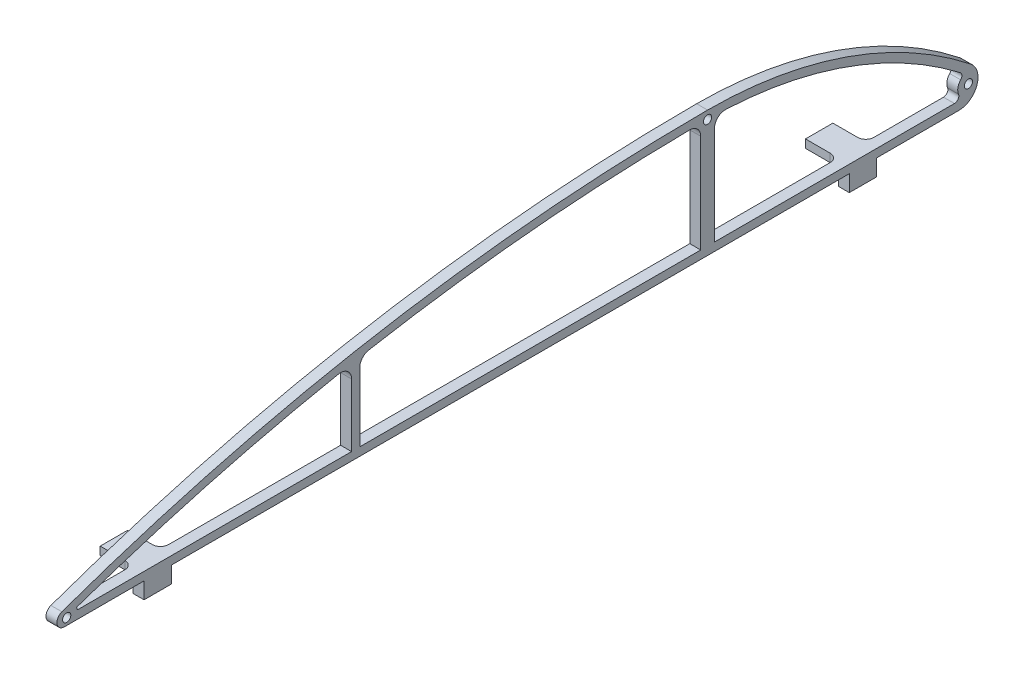
from build123d import *

# Parameters (mm, degrees)
BOSS_EXTRU_1_DEPTH      = 2
ESQUISSE4_R             = 0.75
ENL_V_MAT_EXTRU_2_DEPTH = 176.894862906
ENL_V_MAT_EXTRU_3_DEPTH = 4
CONG_2_R                = 1.35
ESQUISSE12_W            = 2
ESQUISSE12_H            = 5
BOSS_EXTRU_2_DEPTH      = 3
CONG_3_R                = 2
CONG_4_R                = 0.8
ESQUISSE13_W            = 5
ESQUISSE13_H            = 1.5
BOSS_EXTRU_3_DEPTH      = 6
CONG_5_R                = 1.5


with BuildPart() as part:
    # Esquisse2 → Boss.-Extru.1 (new body)
    with BuildSketch(Plane(origin=(0, 0, 0), x_dir=(0, 0, -1), z_dir=(1, 0, 0))):
        with BuildLine():
            Line((0, 0), (170.873171093, 0))
            ThreePointArc((170.873171093, 0), (174.177922559, 2.347343181), (173.049882129, 6.240789861))
            ThreePointArc((173.049882129, 6.240789861), (150.444362328, 18.689979585), (125, 23))
            ThreePointArc((125, 23), (61.450806457, 17.202138822), (0, 0))
        make_face()
    extrude(amount=BOSS_EXTRU_1_DEPTH)

    # Esquisse4 → Enlèv. mat.-Extru.2 (cut, through all)
    with BuildSketch(Plane(origin=(2, 0, 0), x_dir=(0, 0, -1), z_dir=(1, 0, 0))):
        with Locations((125, 21.5)):
            Circle(ESQUISSE4_R)
        with Locations((172.618958832, 3.328337296)):
            Circle(ESQUISSE4_R)
        with Locations((8, 1.25)):
            Circle(ESQUISSE4_R)
    extrude(amount=-ENL_V_MAT_EXTRU_2_DEPTH, mode=Mode.SUBTRACT)

    # Esquisse9 → Enlèv. mat.-Extru.3 (cut)
    with BuildSketch(Plane(origin=(0, 0, 0), x_dir=(0, 0, -1), z_dir=(1, 0, 0))):
        with BuildLine():
            Line((126.249998003, 1.5), (171.940959768, 1.5))
            ThreePointArc((171.940959768, 1.5), (170.669151645, 3.355758734), (171.992643995, 5.175018028))
            ThreePointArc((171.992643995, 5.175018028), (150.464605834, 17.100795028), (126.249998003, 21.497765776))
            Line((126.249998003, 21.497765776), (126.249998003, 1.5))
        make_face()
        with BuildLine():
            Line((9.933907961, 1.5), (60, 1.5))
            Line((60, 1.5), (60, 15.405547145))
            ThreePointArc((60, 15.405547145), (34.654135968, 9.627019927), (9.807619224, 1.981445651))
            ThreePointArc((9.807619224, 1.981445651), (9.886187662, 1.744768736), (9.933907961, 1.5))
        make_face()
        with BuildLine():
            Line((61.5, 1.5), (123.750001997, 1.5))
            Line((123.750001997, 1.5), (123.750001997, 21.497765776))
            ThreePointArc((123.750001997, 21.497765776), (92.494848054, 19.985907384), (61.5, 15.685935533))
            Line((61.5, 15.685935533), (61.5, 1.5))
        make_face()
    extrude(amount=ENL_V_MAT_EXTRU_3_DEPTH, mode=Mode.SUBTRACT)

    # Congé2
    cong_2_edges = [part.edges().sort_by_distance(p)[0] for p in [
        (1, 0, 0),
    ]]
    fillet(cong_2_edges, radius=CONG_2_R)

    # Esquisse12 → Boss.-Extru.2 (add)
    with BuildSketch(Plane.XZ):
        with Locations((1, -153.373171093)):
            Rectangle(ESQUISSE12_W, ESQUISSE12_H)
        with Locations((1, -24.612741703)):
            Rectangle(ESQUISSE12_W, ESQUISSE12_H)
    extrude(amount=BOSS_EXTRU_2_DEPTH)

    # Congé3
    cong_3_edges = [part.edges().sort_by_distance(p)[0] for p in [
        (1, 15.405547145, -60),
        (1, 21.497765776, -126.249998003),
        (1, 21.497765776, -123.750001997),
        (1, 15.685935533, -61.5),
    ]]
    fillet(cong_3_edges, radius=CONG_3_R)

    # Congé4
    cong_4_edges = [part.edges().sort_by_distance(p)[0] for p in [
        (1, 5.175018028, -171.992643995),
        (1, 1.5, -171.940959768),
    ]]
    fillet(cong_4_edges, radius=CONG_4_R)

    # Esquisse13 → Boss.-Extru.3 (add)
    with BuildSketch(Plane.ZY):
        with Locations((-153.373171093, 0.75)):
            Rectangle(ESQUISSE13_W, ESQUISSE13_H)
        with Locations((-24.612741703, 0.75)):
            Rectangle(ESQUISSE13_W, ESQUISSE13_H)
    extrude(amount=BOSS_EXTRU_3_DEPTH)

    # Congé5
    # the kernel refuses this fillet: 1.5 mm, written as the material it adds along each edge
    with BuildSketch(Plane(origin=(0, 1.5, -155.873171093), x_dir=(0, 0, -1), z_dir=(0, -1, 0)), Plane(origin=(0, 0, -150.873171093), x_dir=(0, 0, 1), z_dir=(0, 1, 0)), Plane(origin=(0, 1.5, -27.112741703), x_dir=(0, 0, -1), z_dir=(0, -1, 0)), Plane(origin=(0, 0, -22.112741703), x_dir=(0, 0, 1), z_dir=(0, 1, 0))) as cong_5_piece_1:
        with BuildLine():
            CenterArc((CONG_5_R, -CONG_5_R), CONG_5_R, 90, 90)
            Line((0, -CONG_5_R), (0, 0))
            Line((0, 0), (CONG_5_R, 0))
        make_face()
    extrude(amount=1.5)


solid = part.part
